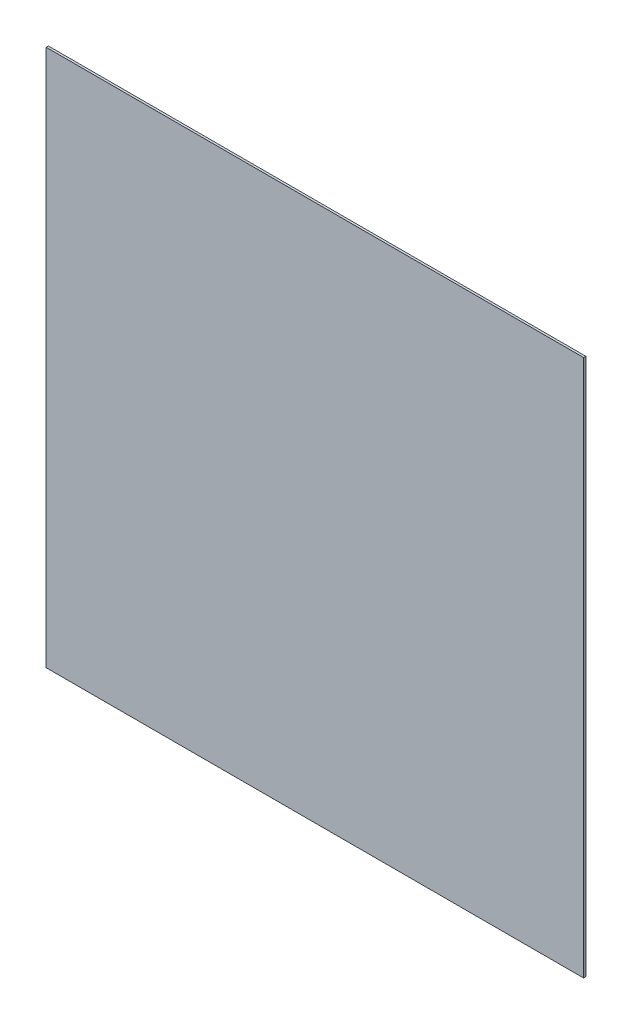
from build123d import *

# Parameters (mm, degrees)
SKETCH1_W           = 765
SKETCH1_H           = 765
BOSS_EXTRUDE1_DEPTH = 3.175


with BuildPart() as part:
    # Sketch1 → Boss-Extrude1 (new body)
    with BuildSketch(Plane.XY):
        Rectangle(SKETCH1_W, SKETCH1_H)
    extrude(amount=BOSS_EXTRUDE1_DEPTH)


solid = part.part
